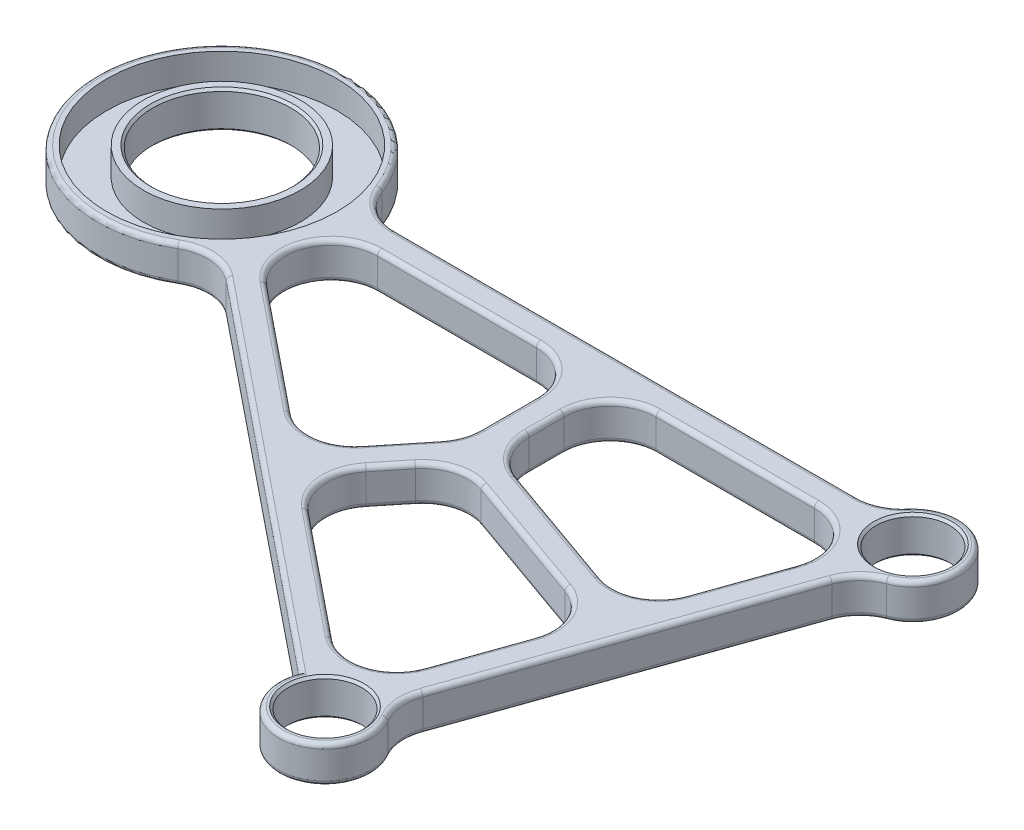
from build123d import *

# Parameters (mm, degrees)
ESQUISSE1_R             = 4
BOSS_EXTRU_1_DEPTH      = 4
ESQUISSE2_R             = 12.5
ESQUISSE2_R_2           = 8.5
ENL_V_MAT_EXTRU_1_DEPTH = 3
ESQUISSE3_R             = 7.5
ENL_V_MAT_EXTRU_2_DEPTH = 4
CONG_1_R                = 5
CONG_2_R                = 5
CONG_3_R                = 0.5
CHANFREIN1_SIZE         = 0.25


with BuildPart() as part:
    # Esquisse1 → Boss.-Extru.1 (new body)
    with BuildSketch(Plane(origin=(0, 0, 0), x_dir=(1, 0, 0), z_dir=(0, 1, 0))):
        with BuildLine():
            Line((-28.720810356, 16.397756372), (28.093085772, 16.397756372))
            ThreePointArc((28.093085772, 16.397756372), (36.945264684, 17.784507718), (32.687096673, 9.900843851))
            Line((32.687096673, 9.900843851), (19.200227344, -28.245783186))
            ThreePointArc((19.200227344, -28.245783186), (17.556942748, -37.05394795), (11.54354251, -30.411420693))
            Line((11.54354251, -30.411420693), (-32.645043367, 5.298349278))
            ThreePointArc((-32.645043367, 5.298349278), (-54.865140282, 19.397756372), (-28.720810356, 16.397756372))
        make_face()
        with Locations(Location((32.862781779, 14.897756372, 0), (0, 0, 270))):
            Circle(ESQUISSE1_R, mode=Mode.SUBTRACT)
        with Locations(Location((16.196115113, -32.242695707, 0), (0, 0, 270))):
            Circle(ESQUISSE1_R, mode=Mode.SUBTRACT)
        with BuildLine():
            Line((-28.720810356, 13.397756372), (-1.5, 13.397756372))
            Line((-1.5, 13.397756372), (-1.5, 0.530330086))
            Line((-1.5, 0.530330086), (-9.587683896, -9.477668137))
            Line((-9.587683896, -9.477668137), (-30.759425284, 7.631682612))
            ThreePointArc((-30.759425284, 7.631682612), (-29.409296159, 10.397756372), (-28.720810356, 13.397756372))
        make_face(mode=Mode.SUBTRACT)
        with BuildLine():
            Line((29.858669548, 10.900843851), (23.615234884, -6.758256105))
            Line((23.615234884, -6.758256105), (1.5, 1.060660172))
            Line((1.5, 1.060660172), (1.5, 13.397756372))
            Line((1.5, 13.397756372), (28.093085772, 13.397756372))
            ThreePointArc((28.093085772, 13.397756372), (28.780298875, 12.011005026), (29.858669548, 10.900843851))
        make_face(mode=Mode.SUBTRACT)
        with BuildLine():
            Line((13.429160593, -28.07808736), (-7.254350563, -11.36328622))
            Line((-7.254350563, -11.36328622), (0.5, -1.767766953))
            Line((0.5, -1.767766953), (22.615234884, -9.58668323))
            Line((22.615234884, -9.58668323), (16.371800219, -27.245783186))
            ThreePointArc((16.371800219, -27.245783186), (14.835287478, -27.431443464), (13.429160593, -28.07808736))
        make_face(mode=Mode.SUBTRACT)
    extrude(amount=BOSS_EXTRU_1_DEPTH)

    # Esquisse2 → Enlèv. mat.-Extru.1 (cut)
    with BuildSketch(Plane(origin=(0, 4, 0), x_dir=(1, 0, 0), z_dir=(0, 1, 0))):
        with Locations(Location((-42.137218221, 14.897756372, 0), (0, 0, 270))):
            Circle(ESQUISSE2_R)
        with Locations(Location((-42.137218221, 14.897756372, 0), (0, 0, 270))):
            Circle(ESQUISSE2_R_2, mode=Mode.SUBTRACT)
    extrude(amount=-ENL_V_MAT_EXTRU_1_DEPTH, mode=Mode.SUBTRACT)

    # Esquisse3 → Enlèv. mat.-Extru.2 (cut)
    with BuildSketch(Plane(origin=(0, 4, 0), x_dir=(1, 0, 0), z_dir=(0, 1, 0))):
        with Locations(Location((-42.137218221, 14.897756372, 0), (0, 0, 270))):
            Circle(ESQUISSE3_R)
    extrude(amount=-ENL_V_MAT_EXTRU_2_DEPTH, mode=Mode.SUBTRACT)

    # Congé1
    # the kernel refuses this fillet: 5 mm, written as the material it adds along each edge
    with BuildSketch(Plane(origin=(-28.720810356, 0, -16.397756372), x_dir=(-0.23301565344383435, 0, -0.9724729843292012), z_dir=(0, 1, 0))) as cong_1_piece_1:
        with BuildLine():
            CenterArc((3.95264846, -4.96171025), CONG_1_R, 97.095310942, 69.430007908)
            Line((-0.909716462, -3.796631983), (0, 0))
            ThreePointArc((0, 0), (1.667523569, -0.103382324), (3.335047138, 0))
        make_face()
    extrude(amount=4)
    with BuildSketch(Plane(origin=(28.093085772, 0, -16.397756372), x_dir=(-1, 0, 0), z_dir=(0, 1, 0))) as cong_1_piece_2:
        with BuildLine():
            CenterArc((2.82964607, -5), CONG_1_R, 90, 49.458398126)
            ThreePointArc((-0.970024969, -1.75), (-0.396580654, -0.924017762), (0, 0))
            Line((0, 0), (2.82964607, 0))
        make_face()
    extrude(amount=4)
    with BuildSketch(Plane(origin=(32.687096673, 0, -9.900843851), x_dir=(0.9862037230508544, 0, -0.16553614904495517), z_dir=(0, 1, 0)), Plane(origin=(28.093085772, 0, -13.397756372), x_dir=(0.4848035523785485, 0, 0.874623070585918), z_dir=(0, 1, 0)), Plane(origin=(16.371800219, 0, 27.245783186), x_dir=(-0.9862037230508537, 0, 0.1655361490449589), z_dir=(0, 1, 0))) as cong_1_piece_3:
        with BuildLine():
            CenterArc((3.001292886, -4.898891496), CONG_1_R, 101.541999375, 49.458398126)
            Line((-1.371822467, -2.474873734), (0, 0))
            ThreePointArc((0, 0), (1.000430962, -0.101108504), (2.000861924, 0))
        make_face()
    extrude(amount=4)
    with BuildSketch(Plane(origin=(19.200227344, 0, 28.245783186), x_dir=(0.6630013547984887, 0, 0.7486181961022377), z_dir=(0, 1, 0)), Plane(origin=(29.858669548, 0, -10.900843851), x_dir=(-0.6630013547984867, 0, -0.7486181961022396), z_dir=(0, 1, 0)), Plane(origin=(13.429160593, 0, 28.07808736), x_dir=(0.9268044555775469, 0, -0.3755442731844104), z_dir=(0, 1, 0))) as cong_1_piece_4:
        with BuildLine():
            CenterArc((3.001292886, 4.898891496), CONG_1_R, 208.999602499, 49.458398126)
            Line((-1.371822467, 2.474873734), (0, 0))
            ThreePointArc((0, 0), (1.000430962, 0.101108504), (2.000861924, 0))
        make_face()
    extrude(amount=4)
    with BuildSketch(Plane(origin=(-32.645043367, 0, -5.298349278), x_dir=(-0.7924719453362253, 0, 0.6099083667691554), z_dir=(0, 1, 0)), Plane(origin=(-28.720810356, 0, -13.397756372), x_dir=(-0.23301565344383335, 0, 0.9724729843292015), z_dir=(0, 1, 0))) as cong_1_piece_5:
        with BuildLine():
            CenterArc((3.95264846, 4.96171025), CONG_1_R, 193.47468115, 69.430007908)
            Line((-0.909716462, 3.796631983), (0, 0))
            ThreePointArc((0, 0), (1.667523569, 0.103382324), (3.335047138, 0))
        make_face()
    extrude(amount=4)
    with BuildSketch(Plane(origin=(-30.759425284, 0, -7.631682612), x_dir=(0.777777777777778, 0, 0.6285393610547088), z_dir=(0, 1, 0))) as cong_1_piece_6:
        with BuildLine():
            CenterArc((3.904100211, 5), CONG_1_R, 200.569992092, 69.430007908)
            ThreePointArc((-0.777118188, 3.243243243), (-0.288022577, 1.645711321), (0, 0))
            Line((0, 0), (3.904100211, 0))
        make_face()
    extrude(amount=4)
    with BuildSketch(Plane(origin=(-9.587683896, 0, 9.477668137), x_dir=(-0.7777777777777779, 0, -0.6285393610547088), z_dir=(0, 1, 0)), Plane(origin=(-1.5, 0, -13.397756372), x_dir=(0, 0, 1), z_dir=(0, 1, 0)), Plane(origin=(1.5, 0, -13.397756372), x_dir=(1, 0, 0), z_dir=(0, 1, 0)), Plane(origin=(22.615234884, 0, 9.58668323), x_dir=(-0.3333333333333328, 0, 0.9428090415820636), z_dir=(0, 1, 0))) as cong_1_piece_7:
        with BuildLine():
            CenterArc((CONG_1_R, -CONG_1_R), CONG_1_R, 90, 90)
            Line((0, -CONG_1_R), (0, 0))
            Line((0, 0), (CONG_1_R, 0))
        make_face()
    extrude(amount=4)
    with BuildSketch(Plane(origin=(-1.5, 0, -0.530330086), x_dir=(-0.6285393610547093, 0, 0.7777777777777775), z_dir=(0, 1, 0))) as cong_1_piece_8:
        with BuildLine():
            CenterArc((CONG_1_R * 0.353553390593, -CONG_1_R), CONG_1_R, 90, 38.942441269)
            Line((-CONG_1_R * 0.274985970461, -CONG_1_R * 0.222222222222), (0, 0))
            Line((0, 0), (CONG_1_R * 0.353553390593, 0))
        make_face()
    extrude(amount=4)
    with BuildSketch(Plane(origin=(1.5, 0, -1.060660172), x_dir=(0, 0, -1), z_dir=(0, 1, 0)), Plane(origin=(0.5, 0, 1.767766953), x_dir=(0.9428090415820635, 0, 0.3333333333333329), z_dir=(0, 1, 0))) as cong_1_piece_9:
        with BuildLine():
            CenterArc((CONG_1_R * 0.707106781187, -CONG_1_R), CONG_1_R, 90, 70.528779366)
            Line((-CONG_1_R * 0.235702260396, -CONG_1_R * 0.666666666667), (0, 0))
            Line((0, 0), (CONG_1_R * 0.707106781187, 0))
        make_face()
    extrude(amount=4)
    with BuildSketch(Plane(origin=(23.615234884, 0, 6.758256105), x_dir=(0.33333333333333354, 0, -0.9428090415820632), z_dir=(0, 1, 0)), Plane(origin=(-7.254350563, 0, 11.36328622), x_dir=(0.7777777777777775, 0, 0.6285393610547093), z_dir=(0, 1, 0))) as cong_1_piece_10:
        with BuildLine():
            CenterArc((CONG_1_R, CONG_1_R), CONG_1_R, 180, 90)
            Line((0, CONG_1_R), (0, 0))
            Line((0, 0), (CONG_1_R, 0))
        make_face()
    extrude(amount=4)

    # Congé2
    cong_2_edges = [part.edges().sort_by_distance(p)[0] for p in [
        (-29.400622927, 2, -10.394689922),
        (14.823602123, 2, 27.390129494),
        (28.745242809, 2, -11.986216644),
    ]]
    fillet(cong_2_edges, radius=CONG_2_R)

    # Congé3
    cong_3_edges = [part.edges().sort_by_distance(p)[0] for p in [
        (16.566759356, 4, 37.228939067),
        (-15.126220955, 0, -13.397756372),
        (-15.126220955, 4, -13.397756372),
        (36.945264684, 0, -17.784507718),
        (36.945264684, 4, -17.784507718),
        (25.943662008, 0, 9.172469668),
        (25.943662008, 4, 9.172469668),
        (10.867261505, 0, 5.433147409),
        (10.867261505, 4, 5.433147409),
        (-2.91693799, 0, 5.996011994),
        (-2.91693799, 4, 5.996011994),
        (3.311913624, 0, 19.902117144),
        (3.311913624, 4, 19.902117144),
        (26.833170191, 0, -2.343439404),
        (26.833170191, 4, -2.343439404),
        (11.867261505, 0, 2.604720284),
        (11.867261505, 4, 2.604720284),
        (1.5, 0, -6.496975225),
        (1.5, 4, -6.496975225),
        (-4.528049101, 0, 3.216689507),
        (-4.528049101, 4, 3.216689507),
        (-1.5, 0, -5.347926705),
        (-1.5, 4, -5.347926705),
        (-32.382638915, 0, -3.941976193),
        (-32.382638915, 4, -3.941976193),
        (-27.664184132, 0, -17.287781689),
        (-27.664184132, 4, -17.287781689),
        (27.355089769, 0, -16.856280841),
        (27.355089769, 4, -16.856280841),
        (32.87339902, 0, -9.052213057),
        (32.87339902, 4, -9.052213057),
        (19.878527027, 0, 27.702835371),
        (19.878527027, 4, 27.702835371),
        (0.805839032, 0, 2.84907122),
        (0.805839032, 4, 2.84907122),
        (-5.194846796, 0, 11.144731619),
        (-5.194846796, 4, 11.144731619),
        (20.746367644, 0, 10.47923974),
        (20.746367644, 4, 10.47923974),
        (22.722678374, 0, 4.889388866),
        (22.722678374, 4, 4.889388866),
        (2.964466094, 0, -11.933290278),
        (2.964466094, 4, -11.933290278),
        (2.417517095, 0, -1.709442732),
        (2.417517095, 4, -1.709442732),
        (-1.785954792, 0, -0.631430372),
        (-1.785954792, 4, -0.631430372),
        (-9.806238498, 0, 7.418164369),
        (-9.806238498, 4, 7.418164369),
        (-2.964466094, 0, -11.933290278),
        (-2.964466094, 4, -11.933290278),
        (19.397299576, 4, 18.688378739),
        (19.397299576, 0, 18.688378739),
        (15.085196812, 0, -13.397756372),
        (15.085196812, 4, -13.397756372),
        (-20.18585575, 0, 0.913051924),
        (-20.18585575, 4, 0.913051924),
        (14.492813363, 0, 26.220614617),
        (14.492813363, 4, 26.220614617),
        (27.752876529, 4, -11.284507718),
        (27.752876529, 0, -11.284507718),
        (-28.466487117, 0, -10.064423039),
        (-28.466487118, 4, -10.064423039),
        (16.566759356, 0, 37.228939067),
        (-9.032489235, 0, 13.783476033),
        (-9.032489235, 4, 13.783476033),
        (-54.865140282, 0, -19.397756372),
        (-54.865140282, 4, -19.397756372),
        (0.223364779, 0, -16.397756372),
        (0.223364779, 4, -16.397756372),
    ]]
    fillet(cong_3_edges, radius=CONG_3_R)

    # Chanfrein1
    chanfrein1_edges = [part.edges().sort_by_distance(p)[0] for p in [
        (32.862781779, 0, -18.897756372),
        (32.862781779, 4, -18.897756372),
        (16.196115113, 0, 28.242695707),
        (16.196115113, 4, 28.242695707),
        (-42.137218221, 4, -22.397756372),
        (-42.137218221, 0, -22.397756372),
    ]]
    chamfer(chanfrein1_edges, length=CHANFREIN1_SIZE)


solid = part.part
